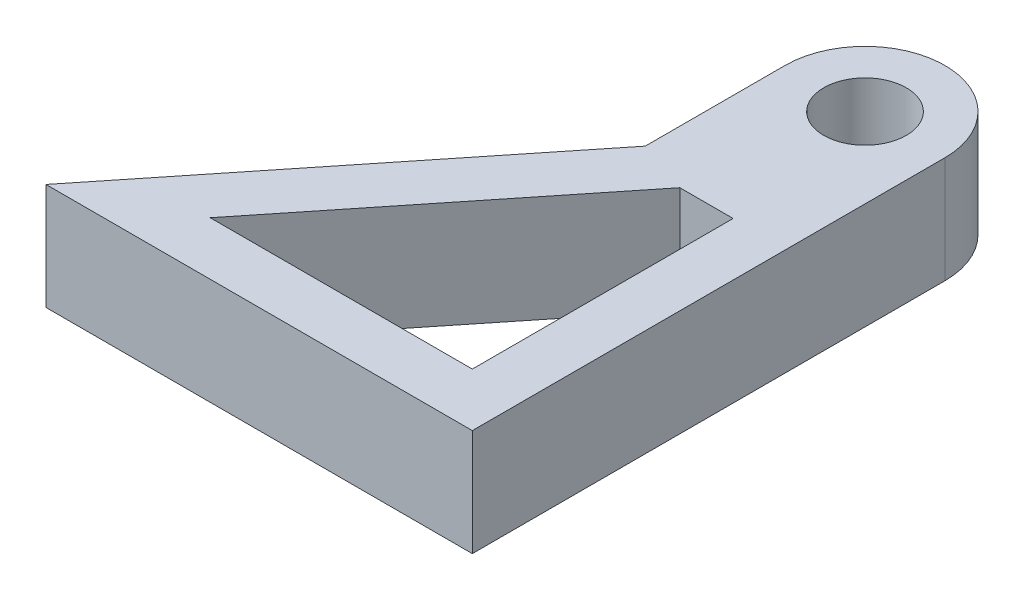
from build123d import *

# Parameters (mm, degrees)
SKETCH1_R           = 7.75
BOSS_EXTRUDE1_DEPTH = 20
CUT_EXTRUDE1_DEPTH  = 37


with BuildPart() as part:
    # Sketch1 → Boss-Extrude1 (new body)
    with BuildSketch(Plane(origin=(0, 0, 0), x_dir=(1, 0, 0), z_dir=(0, 1, 0))):
        with BuildLine():
            Line((-15, 0), (-15.006952556, -26.238275495))
            Line((-15.006952556, -26.238275495), (-65.001652527, -88.69249853))
            Line((-65.001652527, -88.69249853), (15, -88.69249853))
            Line((15, -88.69249853), (15, 0))
            ThreePointArc((15, 0), (0, 14.996025862), (-15, 0))
        make_face()
        Circle(SKETCH1_R, mode=Mode.SUBTRACT)
    extrude(amount=BOSS_EXTRUDE1_DEPTH)

    # Sketch3 → Cut-Extrude1 (cut)
    with BuildSketch(Plane.XZ):
        Polygon((5, 29.748964551), (-5.007882459, 29.748964551), (-44.187255413, 78.69249853), (5, 78.69249853), align=None)
    extrude(amount=-CUT_EXTRUDE1_DEPTH, mode=Mode.SUBTRACT)


solid = part.part
